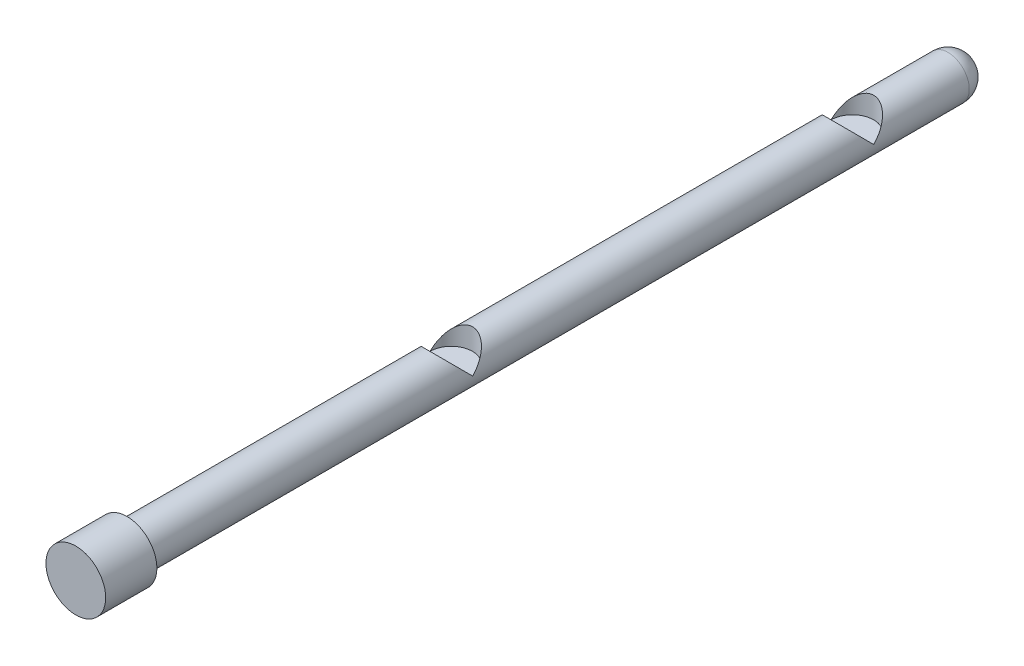
from build123d import *
from build123d.topology import SkipClean

# Parameters (mm, degrees)
SKETCH1_R           = 12.5
BOSS_EXTRUDE1_DEPTH = 425
SKETCH3_R           = 17.5
BOSS_EXTRUDE2_DEPTH = 30
SKETCH7_R           = 12.5
CUT_EXTRUDE1_DEPTH  = 20
BOSS_EXTRUDE4_START = 212.5
SKETCH10_R          = 12.5
BOSS_EXTRUDE4_DEPTH = 212.5
SKETCH12_R          = 12.5
CUT_EXTRUDE2_DEPTH  = 212.5
SKETCH14_R          = 12.5
CUT_EXTRUDE3_DEPTH  = 106.25
SKETCH16_R          = 12.5
CUT_EXTRUDE4_DEPTH  = 50.25


with BuildPart() as part:
    # Sketch1 → Boss-Extrude1 (new body)
    with BuildSketch(Plane.XY):
        Circle(SKETCH1_R)
    extrude(amount=BOSS_EXTRUDE1_DEPTH)

    # Sketch7 → Cut-Extrude1 (cut)
    with BuildSketch(Plane(origin=(0, 0, 0), x_dir=(1, 0, 0), z_dir=(0, 1, 0))):
        with Locations((0, -235)):
            Circle(SKETCH7_R)
    extrude(amount=CUT_EXTRUDE1_DEPTH, mode=Mode.SUBTRACT)

    # Sketch10 → Boss-Extrude4 (add)
    with BuildSketch(Plane(origin=(0, 0, 0), x_dir=(-1, 0, 0), z_dir=(0, 0, -1)).offset(BOSS_EXTRUDE4_START)):
        Circle(SKETCH10_R)
    extrude(amount=-BOSS_EXTRUDE4_DEPTH)

    # Sketch12 → Cut-Extrude2 (cut)
    with BuildSketch(Plane(origin=(0, 0, 0), x_dir=(1, 0, 0), z_dir=(0, 1, 0))):
        Circle(SKETCH12_R)
    extrude(amount=CUT_EXTRUDE2_DEPTH, mode=Mode.SUBTRACT)

    # Sketch14 → Cut-Extrude3 (cut)
    with BuildSketch(Plane(origin=(0, 0, -212.5), x_dir=(-1, 0, 0), z_dir=(0, 0, -1))):
        Circle(SKETCH14_R)
    extrude(amount=-CUT_EXTRUDE3_DEPTH, mode=Mode.SUBTRACT)

    # Sketch16 → Cut-Extrude4 (cut)
    with BuildSketch(Plane(origin=(0, 0, -106.25), x_dir=(-1, 0, 0), z_dir=(0, 0, -1))):
        Circle(SKETCH16_R)
    extrude(amount=-CUT_EXTRUDE4_DEPTH, mode=Mode.SUBTRACT)

    # Sketch17 → Revolve3 (revolve)
    with SkipClean():  # the faces are left unmerged after this step: merging them gives an invalid solid
        with BuildSketch(Plane(origin=(0, 0, 0), x_dir=(0, 0, -1), z_dir=(1, 0, 0))):
            with BuildLine():
                Line((56, 12.5), (56, -12.5))
                ThreePointArc((56, -12.5), (68.5, 0), (56, 12.5))
            make_face()
        revolve(axis=Axis((0, 12.5, -56), (0, -1, 0)))


with BuildPart() as body_2:
    # Sketch3 → Boss-Extrude2 (new body)
    with BuildSketch(Plane.XY.offset(425)):
        Circle(SKETCH3_R)
    extrude(amount=BOSS_EXTRUDE2_DEPTH)


solid = Compound([part.part, body_2.part])
